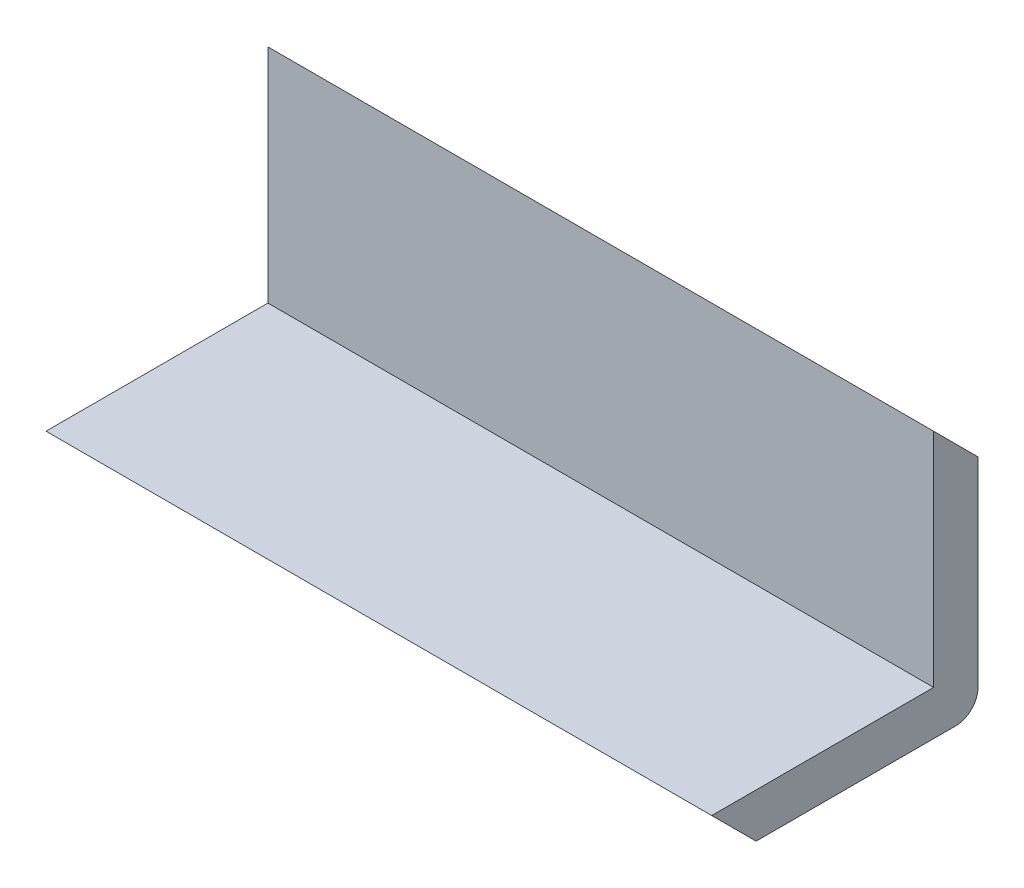
from build123d import *

# Parameters (mm, degrees)
CROQUIS1_W                   = 30
CROQUIS1_H                   = 10
SALIENTE_EXTRUIR1_DEPTH      = 2
SALIENTE_EXTRUIR2_DEPTH      = 10
SALIENTE_EXTRUIR2_DEPTH_BACK = 2
CROQUIS2_W                   = 30
CROQUIS2_H                   = 2
CHAFL_N1_SIZE                = 2
REDONDEO2_R                  = 1
CHAFL_N2_SIZE                = 2
CORTAR_EXTRUIR1_DEPTH        = 1.2


with BuildPart() as part:
    # Croquis1 → Saliente-Extruir1 (new body)
    with BuildSketch(Plane(origin=(0, 0, 0), x_dir=(1, 0, 0), z_dir=(0, 1, 0))):
        Rectangle(CROQUIS1_W, CROQUIS1_H)
    extrude(amount=SALIENTE_EXTRUIR1_DEPTH)

    # Croquis2 → Saliente-Extruir2 (add, two sides: drawn at the far end of the back side and taken through both)
    with BuildSketch(Plane(origin=(0, 2, 0), x_dir=(1, 0, 0), z_dir=(0, 1, 0)).offset(-SALIENTE_EXTRUIR2_DEPTH_BACK)):
        with Locations((0, 6)):
            Rectangle(CROQUIS2_W, CROQUIS2_H)
    extrude(amount=SALIENTE_EXTRUIR2_DEPTH + SALIENTE_EXTRUIR2_DEPTH_BACK)

    # Chaflán1
    chafl_n1_edges = [part.edges().sort_by_distance(p)[0] for p in [
        (0, 12, -7),
    ]]
    chamfer(chafl_n1_edges, length=CHAFL_N1_SIZE - 0.0001)  # a hair under: the kernel refuses the full size

    # Redondeo2
    redondeo2_edges = [part.edges().sort_by_distance(p)[0] for p in [
        (0, 0, -7),
    ]]
    fillet(redondeo2_edges, radius=REDONDEO2_R)

    # Chaflán2
    chafl_n2_edges = [part.edges().sort_by_distance(p)[0] for p in [
        (0, 0, 5),
    ]]
    chamfer(chafl_n2_edges, length=CHAFL_N2_SIZE - 0.0001)  # a hair under: the kernel refuses the full size

    # Croquis3 → Cortar-Extruir1 (cut)
    # profile 1 of 4: a face of its own
    with BuildSketch(Plane(origin=(0, 0, -7), x_dir=(-1, 0, 0), z_dir=(0, 0, -1))):
        with BuildLine():
            ThreePointArc((2.179461585, 1.712836764), (-0.003829875, 1.526509248), (-2.187121335, 1.712836764))
            ThreePointArc((-2.187121335, 1.712836764), (-3.13057186, 3.360317888), (-3.474170032, 5.227463636))
            Line((-3.474170032, 5.227463636), (-2.805590027, 5.46631384))
            Line((-2.805590027, 5.46631384), (-2.500896715, 7.575051077))
            ThreePointArc((-2.500896715, 7.575051077), (0.006930249, 8.492471905), (2.514756719, 7.575049726))
            Line((2.514756719, 7.575049726), (2.800592253, 5.46631384))
            Line((2.800592253, 5.46631384), (3.47129645, 5.243848676))
            ThreePointArc((3.47129645, 5.243848676), (3.146201029, 3.360968701), (2.179461585, 1.712836764))
        make_face()
        with BuildLine():
            ThreePointArc((3.04052308, 4.945192572), (2.706972006, 3.446787944), (1.968364572, 2.101079281))
            ThreePointArc((1.968364572, 2.101079281), (0.001181819, 1.952323974), (-1.966000935, 2.101079281))
            ThreePointArc((-1.966000935, 2.101079281), (-2.687956628, 3.454054765), (-3.046105657, 4.945192572))
            ThreePointArc((-3.046105657, 4.945192572), (-2.637562578, 5.123424768), (-2.352779772, 5.46631384))
            Line((-2.352779772, 5.46631384), (-2.105696131, 7.381547512))
            ThreePointArc((-2.105696131, 7.381547512), (0.008132207, 8.005941127), (2.121960546, 7.381547512))
            Line((2.121960546, 7.381547512), (2.381567187, 5.46631384))
            ThreePointArc((2.381567187, 5.46631384), (2.633474347, 5.107665237), (3.04052308, 4.945192572))
        make_face(mode=Mode.SUBTRACT)
    # profile 2 of 4: a face of its own
    with BuildSketch(Plane(origin=(0, 0, -7), x_dir=(-1, 0, 0), z_dir=(0, 0, -1))):
        with BuildLine():
            Line((2.92199069, 8.735458595), (2.92199069, 6.324796966))
            ThreePointArc((2.92199069, 6.324796966), (3.056721571, 5.999527847), (3.38199069, 5.864796966))
            Line((3.38199069, 5.864796966), (3.880095869, 5.864796966))
            ThreePointArc((3.880095869, 5.864796966), (4.205364988, 5.999527847), (4.340095869, 6.324796966))
            Line((4.340095869, 6.324796966), (4.340095869, 8.735458595))
            ThreePointArc((4.340095869, 8.735458595), (4.205364988, 9.060727715), (3.880095869, 9.195458595))
            Line((3.880095869, 9.195458595), (3.38199069, 9.195458595))
            ThreePointArc((3.38199069, 9.195458595), (3.056721571, 9.060727715), (2.92199069, 8.735458595))
        make_face()
        with BuildLine():
            ThreePointArc((3.47129645, 8.849051475), (3.398492736, 8.818895189), (3.36833645, 8.746091475))
            Line((3.36833645, 8.746091475), (3.36833645, 6.314164086))
            ThreePointArc((3.36833645, 6.314164086), (3.398492736, 6.241360372), (3.47129645, 6.211204086))
            Line((3.47129645, 6.211204086), (3.923270109, 6.211204086))
            ThreePointArc((3.923270109, 6.211204086), (3.996073823, 6.241360372), (4.026230109, 6.314164086))
            Line((4.026230109, 6.314164086), (4.026230109, 8.746091475))
            ThreePointArc((4.026230109, 8.746091475), (3.996073823, 8.818895189), (3.923270109, 8.849051475))
            Line((3.923270109, 8.849051475), (3.47129645, 8.849051475))
        make_face(mode=Mode.SUBTRACT)
    # profile 3 of 4: a face of its own
    with BuildSketch(Plane(origin=(0, 0, -7), x_dir=(-1, 0, 0), z_dir=(0, 0, -1))):
        Polygon((1.255664584, 4.877844546), (0.417947415, 2.921183382), (-0.779631115, 2.921183382), (-0.18084185, 4.441551322), (-1.228472775, 4.441551322), (0.599464258, 7.052448867), (0.113938081, 4.877844546), align=None)
    # profile 4 of 4: a face of its own
    with BuildSketch(Plane(origin=(0, 0, -7), x_dir=(-1, 0, 0), z_dir=(0, 0, -1))):
        with BuildLine():
            Line((-4.462655299, 8.747249221), (-4.462655299, 6.336587592))
            ThreePointArc((-4.462655299, 6.336587592), (-4.308523171, 5.964479719), (-3.936415299, 5.810347592))
            Line((-3.936415299, 5.810347592), (-3.43831012, 5.810347592))
            ThreePointArc((-3.43831012, 5.810347592), (-3.066202247, 5.964479719), (-2.91207012, 6.336587592))
            Line((-2.91207012, 6.336587592), (-2.91207012, 8.747249221))
            ThreePointArc((-2.91207012, 8.747249221), (-3.066202247, 9.119357093), (-3.43831012, 9.273489221))
            Line((-3.43831012, 9.273489221), (-3.936415299, 9.273489221))
            ThreePointArc((-3.936415299, 9.273489221), (-4.308523171, 9.119357093), (-4.462655299, 8.747249221))
        make_face()
        with BuildLine():
            ThreePointArc((-3.939103691, 8.842918202), (-4.002743301, 8.816557812), (-4.029103691, 8.752918202))
            Line((-4.029103691, 8.752918202), (-4.029103691, 6.320990813))
            ThreePointArc((-4.029103691, 6.320990813), (-4.002743301, 6.257351203), (-3.939103691, 6.230990813))
            Line((-3.939103691, 6.230990813), (-3.544021822, 6.230990813))
            ThreePointArc((-3.544021822, 6.230990813), (-3.480382211, 6.257351203), (-3.454021822, 6.320990813))
            Line((-3.454021822, 6.320990813), (-3.454021822, 8.752918202))
            ThreePointArc((-3.454021822, 8.752918202), (-3.480382211, 8.816557812), (-3.544021822, 8.842918202))
            Line((-3.544021822, 8.842918202), (-3.939103691, 8.842918202))
        make_face(mode=Mode.SUBTRACT)
    extrude(amount=-CORTAR_EXTRUIR1_DEPTH, mode=Mode.SUBTRACT)


solid = part.part
